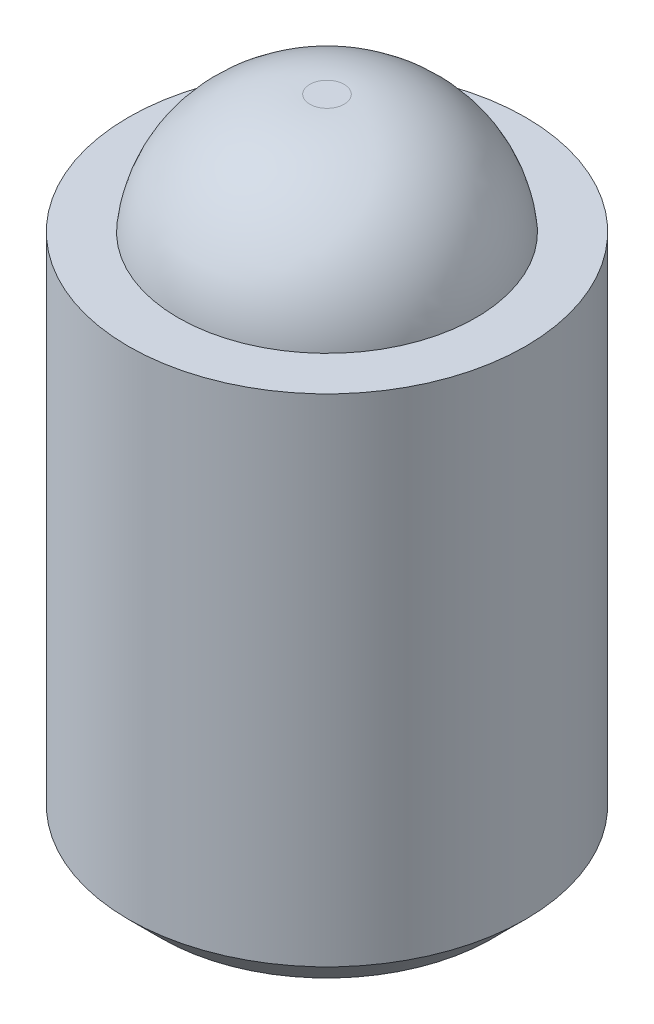
from build123d import *

# Parameters (mm, degrees)
SKETCH_1_R          = 3
EXTRUDE_1_DEPTH     = 8
SKETCH_2_R          = 2.25
EXTRUDE_2_DEPTH     = 1.8
FILLET_2_R          = 2
CHAMFER_1_SIZE      = 0.5
CUT_EXTRUDE_1_DEPTH = 1.8


with BuildPart() as part:
    # 草图1 → 凸台-拉伸1 (new body)
    with BuildSketch(Plane(origin=(0, 0, 0), x_dir=(1, 0, 0), z_dir=(0, 1, 0))):
        with Locations(Location((0, 0, 0), (0, 0, 270))):
            Circle(SKETCH_1_R)
    extrude(amount=EXTRUDE_1_DEPTH)

    # 草图2 → 凸台-拉伸2 (add)
    with BuildSketch(Plane(origin=(0, 8, 0), x_dir=(1, 0, 0), z_dir=(0, 1, 0))):
        with Locations(Location((0, 0, 0), (0, 0, 270))):
            Circle(SKETCH_2_R)
    extrude(amount=EXTRUDE_2_DEPTH)

    # 圆角2
    # the kernel refuses this fillet: 2 mm, written as the material it takes off along each edge
    with BuildSketch(Plane(origin=(0, 9.8, 0), x_dir=(0, 0, 1), z_dir=(-1, 0, 0))) as fillet_2_piece_1:
        with BuildLine():
            CenterArc((0.260025126, -2), FILLET_2_R, 5.739170477, 84.260829523)
            Line((0.260025126, 0), (0.260025126, 0.04))
            Line((0.260025126, 0.04), (2.25, 0.04))
            Line((2.25, 0.04), (2.29, 0))
            ThreePointArc((2.29, 0), (2.29, -0.9), (2.289799497, -1.796))
            Line((2.289799497, -1.796), (2.25, -1.8))
        make_face()
    revolve(axis=Axis((0, 9.8, 0), (0, 1, 0)), mode=Mode.SUBTRACT)

    # 倒角1
    chamfer_1_edges = [part.edges().sort_by_distance(p)[0] for p in [
        (0, 0, -3),
    ]]
    chamfer(chamfer_1_edges, length=CHAMFER_1_SIZE)

    # 草图3 → 切除-拉伸1 (cut)
    with BuildSketch(Plane.XZ):
        Polygon((0, 1.808769012), (-1.566439914, 0.904384506), (-1.566439914, -0.904384506), (0, -1.808769012), (1.566439914, -0.904384506), (1.566439914, 0.904384506), align=None)
    extrude(amount=-CUT_EXTRUDE_1_DEPTH, mode=Mode.SUBTRACT)


solid = part.part
